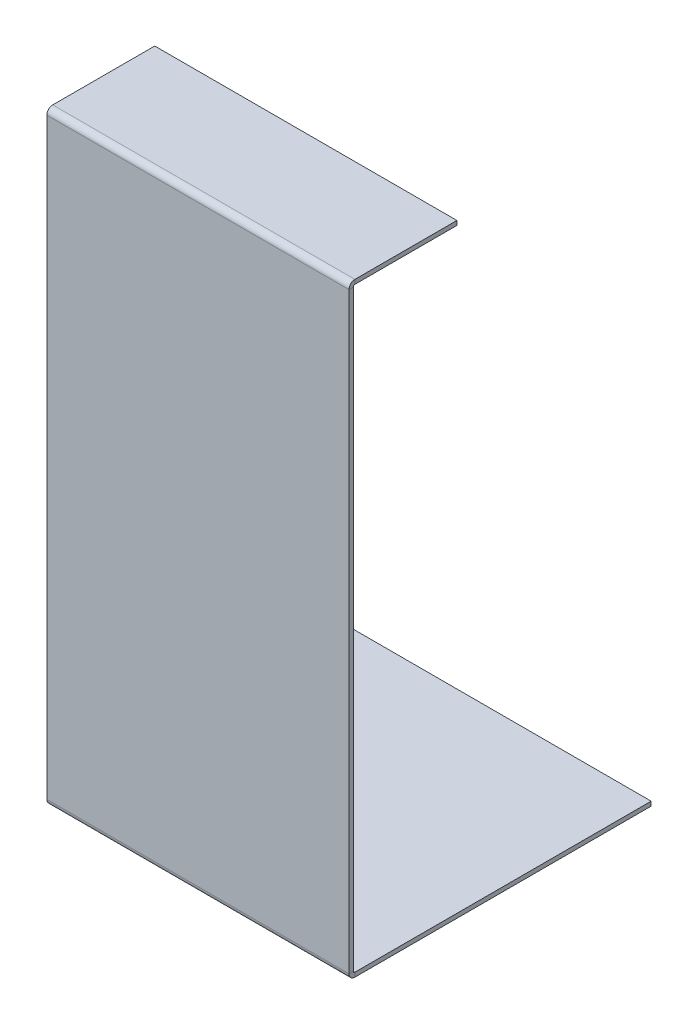
from build123d import *

# Parameters (mm, degrees)
SKETCH1_W                    = 140
SKETCH1_H                    = 140
BASE_FLANGE1_DEPTH           = 2
EDGE_FLANGE2_STRIP_W         = 9.4732
EDGE_FLANGE2_STRIP_H         = 2
EDGE_FLANGE2_STRIP_CUT_DEPTH = 140
EDGE_FLANGE2_DEPTH           = 140
EDGE_FLANGE3_STRIP_W         = 9.4732
EDGE_FLANGE3_STRIP_H         = 2
EDGE_FLANGE3_STRIP_CUT_DEPTH = 140
EDGE_FLANGE3_DEPTH           = 140


# Sheet-metal steps are written as plain solids
with BuildPart() as part:
    # Sketch1 → Base-Flange1 (new body)
    with BuildSketch(Plane(origin=(0, 0, 0), x_dir=(1, 0, 0), z_dir=(0, 1, 0))):
        with Locations((-8.720538721, -25.533108866)):
            Rectangle(SKETCH1_W, SKETCH1_H)
    extrude(amount=-BASE_FLANGE1_DEPTH)

    # Edge-Flange2 strip (across the edge) → Edge-Flange2 strip cut (cut)
    with BuildSketch(Plane(origin=(-78.720538721, 0, 95.533108866), x_dir=(0, 0, -1), z_dir=(1, 0, 0))):
        with Locations((-2, -1)):
            Rectangle(EDGE_FLANGE2_STRIP_W, EDGE_FLANGE2_STRIP_H)
    extrude(amount=EDGE_FLANGE2_STRIP_CUT_DEPTH, mode=Mode.SUBTRACT)

    # Edge-Flange2 section (across the edge) → Edge-Flange2 (add)
    with BuildSketch(Plane(origin=(-78.720538721, 0, 95.533108866), x_dir=(0, 0, -1), z_dir=(1, 0, 0))):
        with BuildLine():
            Line((0, 0.7366), (0, 278))
            Line((0, 278), (2, 278))
            Line((2, 278), (2, 0.7366))
            ThreePointArc((2, 0.7366), (2.215745145, 0.215745145), (2.7366, 0))
            Line((2.7366, 0), (2.7366, -2))
            ThreePointArc((2.7366, -2), (0.801531583, -1.198468417), (0, 0.7366))
        make_face()
    extrude(amount=EDGE_FLANGE2_DEPTH)

    # Edge-Flange3 strip (across the edge) → Edge-Flange3 strip cut (cut)
    with BuildSketch(Plane(origin=(-78.720538721, 278, 93.533108866), x_dir=(0, -1, 0), z_dir=(1, 0, 0))):
        with Locations((-2, -1)):
            Rectangle(EDGE_FLANGE3_STRIP_W, EDGE_FLANGE3_STRIP_H)
    extrude(amount=EDGE_FLANGE3_STRIP_CUT_DEPTH, mode=Mode.SUBTRACT)

    # Edge-Flange3 section (across the edge) → Edge-Flange3 (add)
    with BuildSketch(Plane(origin=(-78.720538721, 278, 93.533108866), x_dir=(0, -1, 0), z_dir=(1, 0, 0))):
        with BuildLine():
            Line((0, 0.7366), (0, 48))
            Line((0, 48), (2, 48))
            Line((2, 48), (2, 0.7366))
            ThreePointArc((2, 0.7366), (2.215745145, 0.215745145), (2.7366, 0))
            Line((2.7366, 0), (2.7366, -2))
            ThreePointArc((2.7366, -2), (0.801531583, -1.198468417), (0, 0.7366))
        make_face()
    extrude(amount=EDGE_FLANGE3_DEPTH)


solid = part.part
